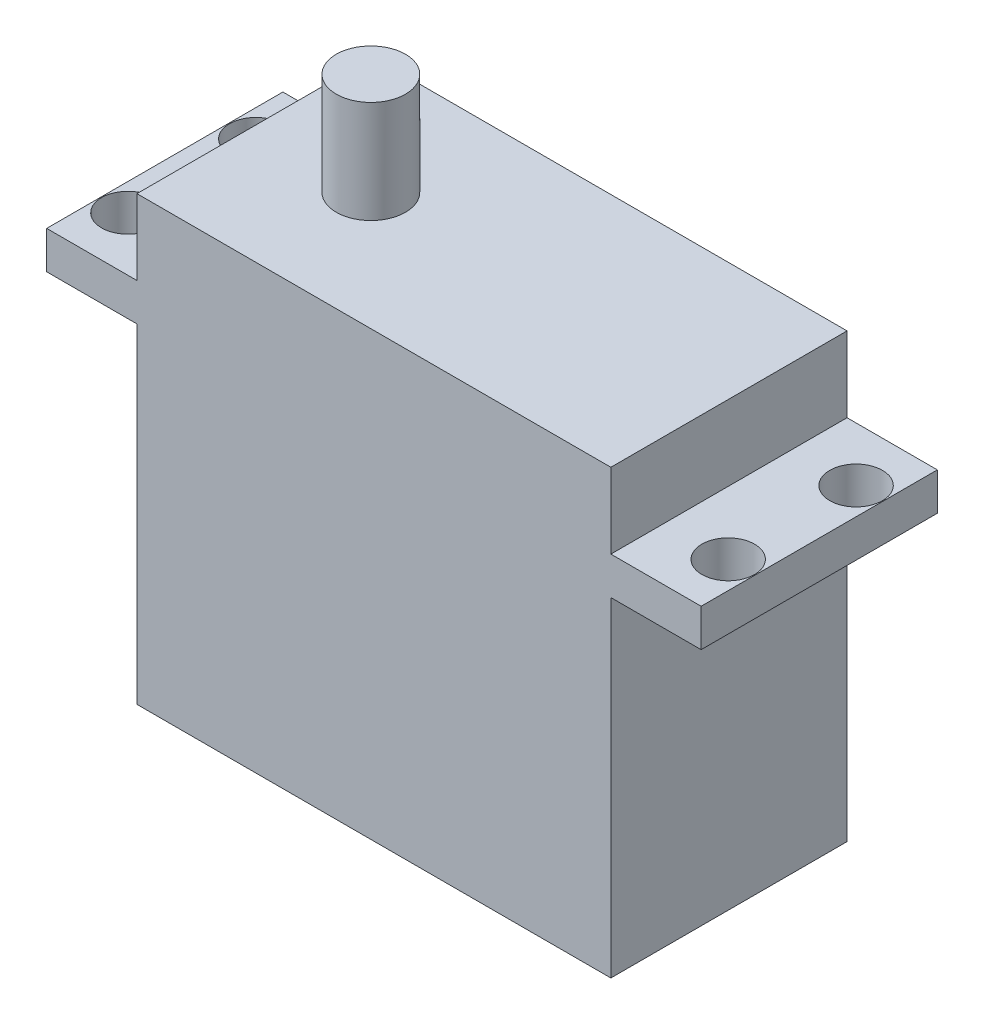
from build123d import *

# Parameters (mm, degrees)
SKETCH1_W           = 40.005
SKETCH1_H           = 19.939
BOSS_EXTRUDE1_DEPTH = 37.338
SKETCH2_W           = 19.939
SKETCH2_H           = 3.175
BOSS_EXTRUDE2_DEPTH = 7.62
SKETCH3_R           = 2.2225
CUT_EXTRUDE1_DEPTH  = 61.215948801
SKETCH4_R           = 2.921
BOSS_EXTRUDE3_DEPTH = 8.636


with BuildPart() as part:
    # Sketch1 → Boss-Extrude1 (new body)
    with BuildSketch(Plane(origin=(0, 0, 0), x_dir=(1, 0, 0), z_dir=(0, 1, 0))):
        with Locations((20.0025, 9.9695)):
            Rectangle(SKETCH1_W, SKETCH1_H)
    extrude(amount=BOSS_EXTRUDE1_DEPTH)

    # Sketch2 → Boss-Extrude2 (add)
    with BuildSketch(Plane(origin=(40.005, 0, 0), x_dir=(0, 0, -1), z_dir=(1, 0, 0))):
        with Locations((9.9695, 29.4005)):
            Rectangle(SKETCH2_W, SKETCH2_H)
    boss_extrude2 = extrude(amount=BOSS_EXTRUDE2_DEPTH)

    # Sketch3 → Cut-Extrude1 (cut, through all)
    with BuildSketch(Plane(origin=(0, 30.988, 0), x_dir=(1, 0, 0), z_dir=(0, 1, 0))):
        with Locations((45.339, 15.367)):
            Circle(SKETCH3_R)
        with Locations((45.339, 4.572)):
            Circle(SKETCH3_R)
    cut_extrude1 = extrude(amount=-CUT_EXTRUDE1_DEPTH, mode=Mode.SUBTRACT)

    # Mirror1: Boss-Extrude2, Cut-Extrude1 across plane
    add(boss_extrude2.mirror(Plane(origin=(20.0025, 0, 0), x_dir=(0, 0, 1), z_dir=(1, 0, 0))))
    add(cut_extrude1.mirror(Plane(origin=(20.0025, 0, 0), x_dir=(0, 0, 1), z_dir=(1, 0, 0))), mode=Mode.SUBTRACT)

    # Sketch4 → Boss-Extrude3 (add)
    with BuildSketch(Plane(origin=(0, 37.338, 0), x_dir=(1, 0, 0), z_dir=(0, 1, 0))):
        with Locations((9.779, 9.9695)):
            Circle(SKETCH4_R)
    extrude(amount=BOSS_EXTRUDE3_DEPTH)


solid = part.part
